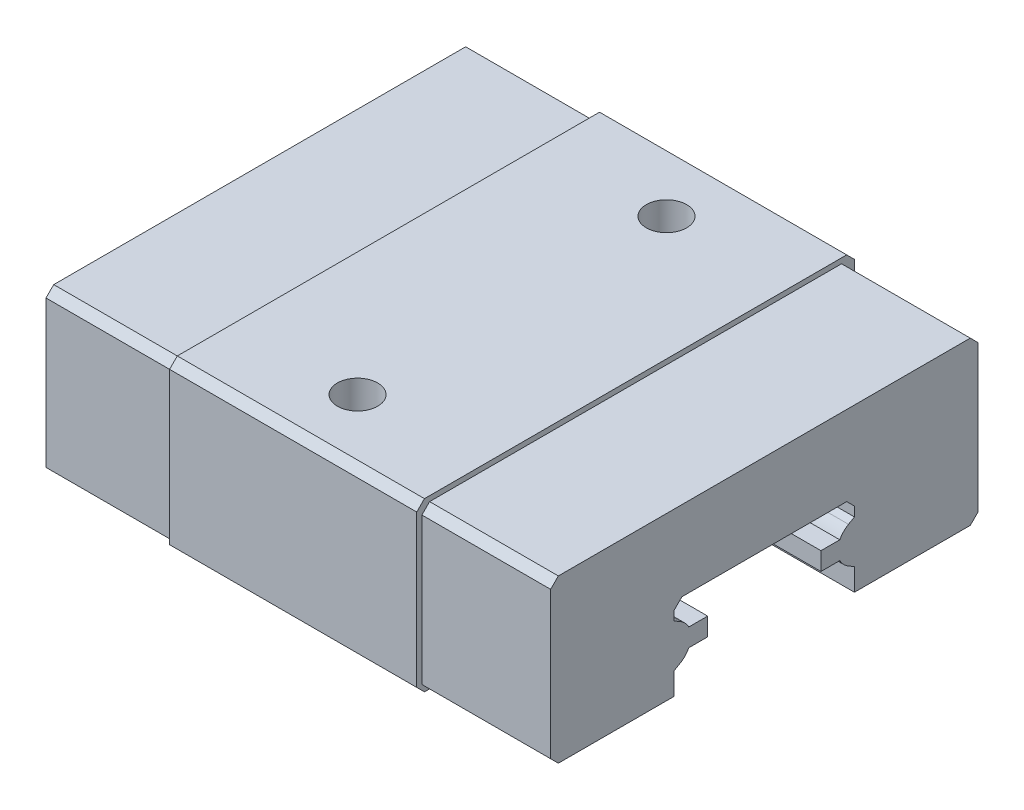
from build123d import *

# Parameters (mm, degrees)
SKETCH1_W               = 16.6
SKETCH1_H               = 6.3
BOSS_EXTRUDE1_DEPTH     = 9.8
SKETCH2_W               = 17
SKETCH2_H               = 6.5
BOSS_EXTRUDE2_DEPTH     = 4.8
CUT_EXTRUDE2_DEPTH      = 16.241062955
CUT_EXTRUDE2_DEPTH_BACK = 16.241062955
CHAMFER1_SIZE           = 0.3
CHAMFER2_SIZE           = 0.3
CHAMFER3_SIZE           = 0.3
CHAMFER4_SIZE           = 0.3
LPATTERN1_COUNT         = 2
LPATTERN1_PITCH         = 12


with BuildPart() as part:
    # Sketch1 → Boss-Extrude1 (new, symmetric)
    with BuildSketch(Plane(origin=(0, 0, 0), x_dir=(0, 0, -1), z_dir=(1, 0, 0))):
        with Locations((0, 4.65)):
            Rectangle(SKETCH1_W, SKETCH1_H)
    extrude(amount=BOSS_EXTRUDE1_DEPTH, both=True)

    # Sketch2 → Boss-Extrude2 (add, symmetric)
    with BuildSketch(Plane(origin=(0, 0, 0), x_dir=(0, 0, -1), z_dir=(1, 0, 0))):
        with Locations((0, 4.75)):
            Rectangle(SKETCH2_W, SKETCH2_H)
    extrude(amount=BOSS_EXTRUDE2_DEPTH, both=True)

    # Sketch3 → Cut-Extrude2 (cut, two sides: drawn at the far end of the back side and taken through both)
    with BuildSketch(Plane(origin=(0, 0, 0), x_dir=(0, 0, -1), z_dir=(1, 0, 0)).offset(-CUT_EXTRUDE2_DEPTH_BACK)):
        with BuildLine():
            Line((-3.2, 4.7), (3.2, 4.7))
            Line((3.2, 4.7), (3.5, 4.4))
            Line((3.5, 4.4), (3.5, 4.034892917))
            Line((3.5, 4.034892917), (3.27, 3.902102355))
            ThreePointArc((3.27, 3.902102355), (3.075750359, 3.750022453), (2.931347317, 3.55))
            Line((2.931347317, 3.55), (2.2, 3.55))
            Line((2.2, 3.55), (2.2, 2.85))
            Line((2.2, 2.85), (2.931347317, 2.85))
            ThreePointArc((2.931347317, 2.85), (3.075750359, 2.649977547), (3.27, 2.497897645))
            Line((3.27, 2.497897645), (3.5, 2.365107083))
            Line((3.5, 2.365107083), (3.5, 0))
            Line((3.5, 0), (-3.5, 0))
            Line((-3.5, 0), (-3.5, 2.365107083))
            Line((-3.5, 2.365107083), (-3.27, 2.497897645))
            ThreePointArc((-3.27, 2.497897645), (-3.075750359, 2.649977547), (-2.931347317, 2.85))
            Line((-2.931347317, 2.85), (-2.2, 2.85))
            Line((-2.2, 2.85), (-2.2, 3.55))
            Line((-2.2, 3.55), (-2.931347317, 3.55))
            ThreePointArc((-2.931347317, 3.55), (-3.075750359, 3.750022453), (-3.27, 3.902102355))
            Line((-3.27, 3.902102355), (-3.5, 4.034892917))
            Line((-3.5, 4.034892917), (-3.5, 4.4))
            Line((-3.5, 4.4), (-3.2, 4.7))
        make_face()
    extrude(amount=CUT_EXTRUDE2_DEPTH + CUT_EXTRUDE2_DEPTH_BACK, mode=Mode.SUBTRACT)

    # Chamfer1
    chamfer1_edges = [part.edges().sort_by_distance(p)[0] for p in [
        (-7.3, 7.8, 8.3),
        (-7.3, 7.8, -8.3),
        (7.3, 7.8, 8.3),
        (7.3, 7.8, -8.3),
    ]]
    chamfer(chamfer1_edges, length=CHAMFER1_SIZE)

    # Chamfer2
    chamfer2_edges = [part.edges().sort_by_distance(p)[0] for p in [
        (0, 8, 8.5),
        (0, 8, -8.5),
    ]]
    chamfer(chamfer2_edges, length=CHAMFER2_SIZE)

    # Chamfer3
    chamfer3_edges = [part.edges().sort_by_distance(p)[0] for p in [
        (-7.3, 1.5, -8.3),
        (-7.3, 1.5, 8.3),
        (7.3, 1.5, -8.3),
        (7.3, 1.5, 8.3),
    ]]
    chamfer(chamfer3_edges, length=CHAMFER3_SIZE)

    # Chamfer4
    chamfer4_edges = [part.edges().sort_by_distance(p)[0] for p in [
        (0, 1.5, 8.5),
        (0, 1.5, -8.5),
    ]]
    chamfer(chamfer4_edges, length=CHAMFER4_SIZE)

    # Sketch4 → Tap1 (revolve, cut)
    with BuildSketch(Plane(origin=(0, 8, -6), x_dir=(0, 0, 1), z_dir=(1, 0, 0))):
        Polygon((0, 0), (0, 3.770774295), (0.7835, 3.3), (0.7835, 0), align=None)
    tap1 = revolve(axis=Axis((0, 8, -6), (0, -1, 0)), mode=Mode.SUBTRACT)

    # LPattern1: Tap1 ×2
    with Locations(*[(0, 0, i * LPATTERN1_PITCH) for i in range(1, LPATTERN1_COUNT)]):
        add(tap1, mode=Mode.SUBTRACT)


solid = part.part
